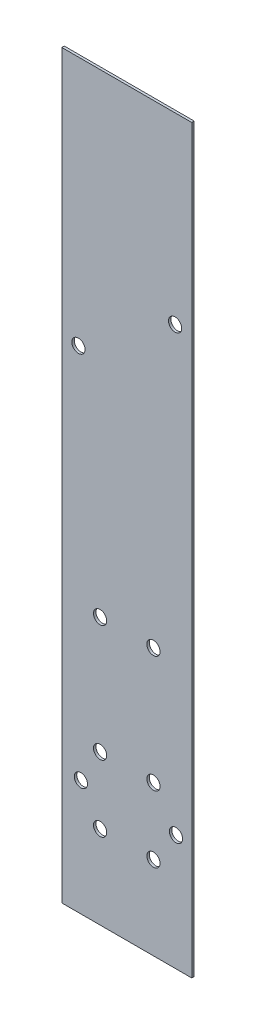
from build123d import *

# Parameters (mm, degrees)
SKETCH1_W          = 39
SKETCH1_H          = 222.25
BASE_FLANGE1_DEPTH = 0.7366
SKETCH2_R          = 1.984375
CUT_EXTRUDE1_DEPTH = 10


# Sheet-metal steps are written as plain solids
with BuildPart() as part:
    # Sketch1 → Base-Flange1 (new body)
    with BuildSketch(Plane.XY):
        with Locations((19.5, 111.125)):
            Rectangle(SKETCH1_W, SKETCH1_H)
    extrude(amount=-BASE_FLANGE1_DEPTH)

    # Sketch2 → Cut-Extrude1 (cut)
    with BuildSketch(Plane.XY):
        with Locations((5, 147.25)):
            Circle(SKETCH2_R)
        with Locations((34, 167.25)):
            Circle(SKETCH2_R)
        with Locations((27.5, 80)):
            Circle(SKETCH2_R)
        with Locations((11.5, 80)):
            Circle(SKETCH2_R)
        with Locations((11.5, 45)):
            Circle(SKETCH2_R)
        with Locations((27.5, 45)):
            Circle(SKETCH2_R)
        with Locations((5.7366, 34.75)):
            Circle(SKETCH2_R)
        with Locations((34.2634, 34.75)):
            Circle(SKETCH2_R)
        with Locations((27.5, 25)):
            Circle(SKETCH2_R)
        with Locations((11.5, 25)):
            Circle(SKETCH2_R)
    extrude(amount=-CUT_EXTRUDE1_DEPTH, mode=Mode.SUBTRACT)


solid = part.part
